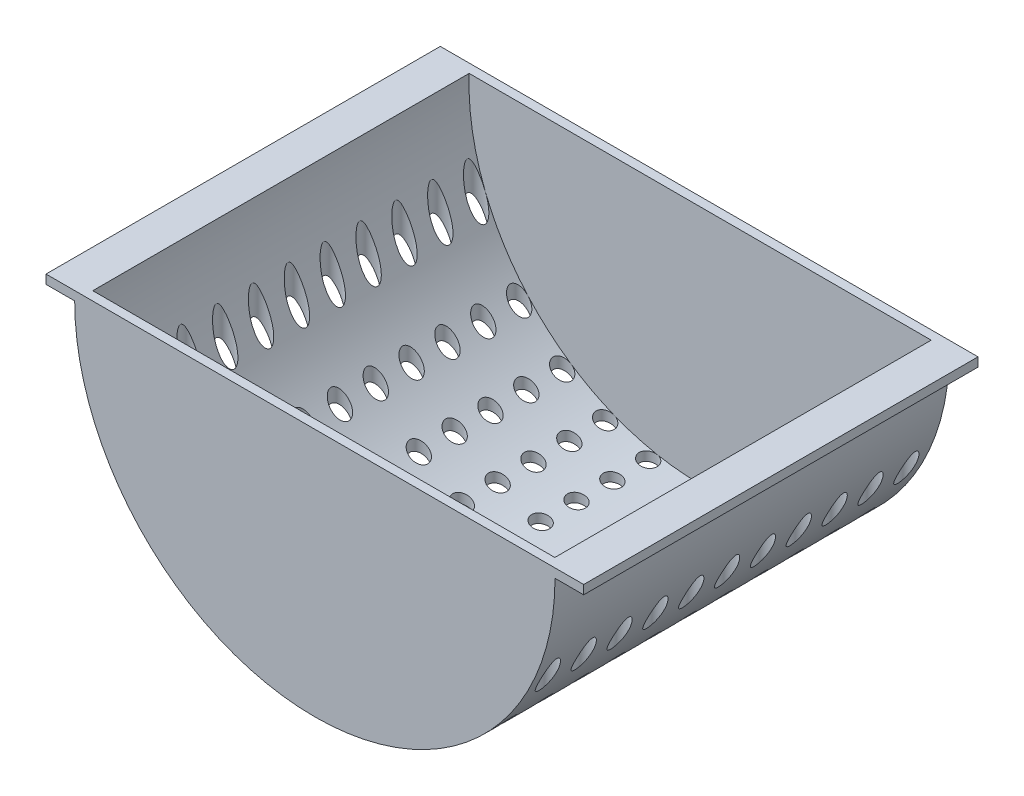
from build123d import *

# Parameters (mm, degrees)
RESSALTO_EXTRUS_O1_DEPTH = 110
CASCA1_START             = 2.5
CASCA1_DEPTH             = 105
ESBO_O3_R                = 2.5000000000000093
ESBO_O3_R_2              = 2.5000000000000027
ESBO_O3_R_3              = 2.5000000000000226
ESBO_O3_R_4              = 2.4999999999999956
CORTE_EXTRUS_O1_DEPTH    = 199.57051644189275


# Read off the part's stored shape, not the designer's step: Casca1
with BuildPart() as part:
    # Esboço2 → Ressalto-extrusão1 (new body)
    with BuildSketch(Plane.XY):
        with BuildLine():
            Line((0, 0), (-150, -1.837e-14))
            Line((-150, -1.837e-14), (-150, -2.5000000000000178))
            Line((-150, -2.5000000000000178), (-141.99999999999997, -2.5000000000000178))
            ThreePointArc((-141.99999999999997, -2.5000000000000178), (-75, -69.5), (-8, -2.4999999999999996))
            Line((-8, -2.4999999999999996), (0, -2.4999999999999996))
            Line((0, -2.4999999999999996), (0, 0))
        make_face()
    extrude(amount=RESSALTO_EXTRUS_O1_DEPTH)

    # Casca1 outline → Casca1 (cut)
    with BuildSketch(Plane.XY.offset(CASCA1_START)):
        with BuildLine():
            ThreePointArc((-139.451532177, 0), (-75, -67), (-10.548467823, 0))
            Line((-10.548467823, 0), (-139.451532177, 0))
        make_face()
    extrude(amount=CASCA1_DEPTH, mode=Mode.SUBTRACT)

    # Esboço3 → Corte-extrusão1 (cut, through all)
    with BuildSketch(Plane(origin=(0, 0, 0), x_dir=(1, 0, 0), z_dir=(0, 1, 0))):
        with Locations(Location((-75, -55, 0), (0, 0, 270))):
            Circle(ESBO_O3_R)
        with Locations(Location((-63, -55, 0), (0, 0, 270))):
            Circle(ESBO_O3_R)
        with Locations(Location((-51, -55, 0), (0, 0, 270))):
            Circle(ESBO_O3_R)
        with Locations(Location((-38.99999999999999, -55, 0), (0, 0, 270))):
            Circle(ESBO_O3_R)
        with Locations(Location((-26.999999999999996, -55, 0), (0, 0, 270))):
            Circle(ESBO_O3_R)
        with Locations(Location((-15, -55, 0), (0, 0, 270))):
            Circle(ESBO_O3_R)
        with Locations(Location((-63.00000000000003, -45, 0), (0, 0, 270))):
            Circle(ESBO_O3_R)
        with Locations(Location((-51.00000000000003, -45, 0), (0, 0, 270))):
            Circle(ESBO_O3_R)
        with Locations(Location((-39.00000000000003, -45, 0), (0, 0, 270))):
            Circle(ESBO_O3_R)
        with Locations(Location((-27.000000000000032, -45, 0), (0, 0, 270))):
            Circle(ESBO_O3_R)
        with Locations(Location((-15.000000000000034, -45, 0), (0, 0, 270))):
            Circle(ESBO_O3_R)
        with Locations(Location((-63.00000000000007, -35, 0), (0, 0, 270))):
            Circle(ESBO_O3_R)
        with Locations(Location((-51.000000000000064, -35, 0), (0, 0, 270))):
            Circle(ESBO_O3_R)
        with Locations(Location((-39.000000000000064, -35, 0), (0, 0, 270))):
            Circle(ESBO_O3_R)
        with Locations(Location((-27.000000000000064, -35, 0), (0, 0, 270))):
            Circle(ESBO_O3_R)
        with Locations(Location((-15.00000000000007, -35, 0), (0, 0, 270))):
            Circle(ESBO_O3_R)
        with Locations(Location((-63.0000000000001, -25, 0), (0, 0, 270))):
            Circle(ESBO_O3_R)
        with Locations(Location((-51.0000000000001, -25, 0), (0, 0, 270))):
            Circle(ESBO_O3_R)
        with Locations(Location((-39.0000000000001, -25, 0), (0, 0, 270))):
            Circle(ESBO_O3_R)
        with Locations(Location((-27.0000000000001, -25, 0), (0, 0, 270))):
            Circle(ESBO_O3_R)
        with Locations(Location((-15.000000000000103, -25, 0), (0, 0, 270))):
            Circle(ESBO_O3_R)
        with Locations(Location((-63.00000000000014, -15, 0), (0, 0, 270))):
            Circle(ESBO_O3_R)
        with Locations(Location((-51.000000000000135, -15, 0), (0, 0, 270))):
            Circle(ESBO_O3_R)
        with Locations(Location((-39.000000000000135, -15, 0), (0, 0, 270))):
            Circle(ESBO_O3_R)
        with Locations(Location((-27.000000000000135, -15, 0), (0, 0, 270))):
            Circle(ESBO_O3_R)
        with Locations(Location((-15.000000000000139, -15, 0), (0, 0, 270))):
            Circle(ESBO_O3_R)
        with Locations(Location((-63.00000000000017, -4.999999999999997, 0), (0, 0, 270))):
            Circle(ESBO_O3_R_2)
        with Locations(Location((-51.00000000000017, -4.999999999999997, 0), (0, 0, 270))):
            Circle(ESBO_O3_R)
        with Locations(Location((-39.00000000000016, -4.999999999999997, 0), (0, 0, 270))):
            Circle(ESBO_O3_R)
        with Locations(Location((-27.00000000000017, -4.999999999999997, 0), (0, 0, 270))):
            Circle(ESBO_O3_R)
        with Locations(Location((-15.000000000000172, -4.999999999999997, 0), (0, 0, 270))):
            Circle(ESBO_O3_R)
        with Locations(Location((-75.00000000000004, -45, 0), (0, 0, 270))):
            Circle(ESBO_O3_R)
        with Locations(Location((-75.00000000000007, -35, 0), (0, 0, 270))):
            Circle(ESBO_O3_R)
        with Locations(Location((-75.00000000000011, -25, 0), (0, 0, 270))):
            Circle(ESBO_O3_R)
        with Locations(Location((-75.00000000000014, -15, 0), (0, 0, 270))):
            Circle(ESBO_O3_R)
        with Locations(Location((-75.00000000000017, -4.999999999999997, 0), (0, 0, 270))):
            Circle(ESBO_O3_R)
        with Locations(Location((-75.00000000000017, -105.00000000000001, 0), (0, 0, 270))):
            Circle(ESBO_O3_R)
        with Locations(Location((-75.00000000000014, -95, 0), (0, 0, 270))):
            Circle(ESBO_O3_R)
        with Locations(Location((-75.00000000000011, -84.99999999999999, 0), (0, 0, 270))):
            Circle(ESBO_O3_R)
        with Locations(Location((-75.00000000000007, -75, 0), (0, 0, 270))):
            Circle(ESBO_O3_R)
        with Locations(Location((-75.00000000000004, -65, 0), (0, 0, 270))):
            Circle(ESBO_O3_R)
        with Locations(Location((-15.000000000000172, -104.99999999999999, 0), (0, 0, 270))):
            Circle(ESBO_O3_R)
        with Locations(Location((-27.00000000000017, -104.99999999999999, 0), (0, 0, 270))):
            Circle(ESBO_O3_R)
        with Locations(Location((-39.00000000000016, -104.99999999999999, 0), (0, 0, 270))):
            Circle(ESBO_O3_R)
        with Locations(Location((-51.00000000000017, -105.00000000000001, 0), (0, 0, 270))):
            Circle(ESBO_O3_R)
        with Locations(Location((-63.00000000000017, -105.00000000000001, 0), (0, 0, 270))):
            Circle(ESBO_O3_R_2)
        with Locations(Location((-15.000000000000139, -94.99999999999999, 0), (0, 0, 270))):
            Circle(ESBO_O3_R)
        with Locations(Location((-27.000000000000135, -94.99999999999999, 0), (0, 0, 270))):
            Circle(ESBO_O3_R)
        with Locations(Location((-39.000000000000135, -94.99999999999999, 0), (0, 0, 270))):
            Circle(ESBO_O3_R)
        with Locations(Location((-51.000000000000135, -95, 0), (0, 0, 270))):
            Circle(ESBO_O3_R)
        with Locations(Location((-63.00000000000014, -95, 0), (0, 0, 270))):
            Circle(ESBO_O3_R)
        with Locations(Location((-15.000000000000103, -84.99999999999999, 0), (0, 0, 270))):
            Circle(ESBO_O3_R)
        with Locations(Location((-27.0000000000001, -84.99999999999999, 0), (0, 0, 270))):
            Circle(ESBO_O3_R)
        with Locations(Location((-39.0000000000001, -84.99999999999999, 0), (0, 0, 270))):
            Circle(ESBO_O3_R)
        with Locations(Location((-51.0000000000001, -84.99999999999999, 0), (0, 0, 270))):
            Circle(ESBO_O3_R)
        with Locations(Location((-63.0000000000001, -84.99999999999999, 0), (0, 0, 270))):
            Circle(ESBO_O3_R)
        with Locations(Location((-15.00000000000007, -74.99999999999999, 0), (0, 0, 270))):
            Circle(ESBO_O3_R)
        with Locations(Location((-27.000000000000064, -74.99999999999999, 0), (0, 0, 270))):
            Circle(ESBO_O3_R)
        with Locations(Location((-39.000000000000064, -74.99999999999999, 0), (0, 0, 270))):
            Circle(ESBO_O3_R)
        with Locations(Location((-51.000000000000064, -74.99999999999999, 0), (0, 0, 270))):
            Circle(ESBO_O3_R)
        with Locations(Location((-63.00000000000007, -75, 0), (0, 0, 270))):
            Circle(ESBO_O3_R)
        with Locations(Location((-15.000000000000034, -64.99999999999999, 0), (0, 0, 270))):
            Circle(ESBO_O3_R)
        with Locations(Location((-27.000000000000032, -64.99999999999999, 0), (0, 0, 270))):
            Circle(ESBO_O3_R)
        with Locations(Location((-39.00000000000003, -65, 0), (0, 0, 270))):
            Circle(ESBO_O3_R)
        with Locations(Location((-51.00000000000003, -65, 0), (0, 0, 270))):
            Circle(ESBO_O3_R)
        with Locations(Location((-63.00000000000003, -65, 0), (0, 0, 270))):
            Circle(ESBO_O3_R)
        with Locations(Location((-87.00000000000033, -65, 0), (0, 0, 270))):
            Circle(ESBO_O3_R)
        with Locations(Location((-99.00000000000033, -65, 0), (0, 0, 270))):
            Circle(ESBO_O3_R)
        with Locations(Location((-111.00000000000033, -65, 0), (0, 0, 270))):
            Circle(ESBO_O3_R_3)
        with Locations(Location((-123.00000000000033, -64.99999999999999, 0), (0, 0, 270))):
            Circle(ESBO_O3_R_4)
        with Locations(Location((-135.0000000000003, -64.99999999999999, 0), (0, 0, 270))):
            Circle(ESBO_O3_R_3)
        with Locations(Location((-87.00000000000028, -75, 0), (0, 0, 270))):
            Circle(ESBO_O3_R)
        with Locations(Location((-99.00000000000028, -74.99999999999999, 0), (0, 0, 270))):
            Circle(ESBO_O3_R_3)
        with Locations(Location((-111.0000000000003, -74.99999999999999, 0), (0, 0, 270))):
            Circle(ESBO_O3_R)
        with Locations(Location((-123.00000000000028, -74.99999999999999, 0), (0, 0, 270))):
            Circle(ESBO_O3_R)
        with Locations(Location((-135.00000000000028, -74.99999999999999, 0), (0, 0, 270))):
            Circle(ESBO_O3_R_3)
        with Locations(Location((-87.00000000000026, -84.99999999999999, 0), (0, 0, 270))):
            Circle(ESBO_O3_R)
        with Locations(Location((-99.00000000000026, -84.99999999999999, 0), (0, 0, 270))):
            Circle(ESBO_O3_R)
        with Locations(Location((-111.00000000000027, -84.99999999999999, 0), (0, 0, 270))):
            Circle(ESBO_O3_R_4)
        with Locations(Location((-123.00000000000024, -84.99999999999999, 0), (0, 0, 270))):
            Circle(ESBO_O3_R_3)
        with Locations(Location((-135.00000000000026, -84.99999999999999, 0), (0, 0, 270))):
            Circle(ESBO_O3_R_4)
        with Locations(Location((-87.00000000000021, -95, 0), (0, 0, 270))):
            Circle(ESBO_O3_R)
        with Locations(Location((-99.00000000000023, -95, 0), (0, 0, 270))):
            Circle(ESBO_O3_R_4)
        with Locations(Location((-111.00000000000023, -94.99999999999999, 0), (0, 0, 270))):
            Circle(ESBO_O3_R)
        with Locations(Location((-123.00000000000023, -94.99999999999999, 0), (0, 0, 270))):
            Circle(ESBO_O3_R_3)
        with Locations(Location((-135.00000000000023, -94.99999999999999, 0), (0, 0, 270))):
            Circle(ESBO_O3_R_4)
        with Locations(Location((-87.00000000000018, -105.00000000000001, 0), (0, 0, 270))):
            Circle(ESBO_O3_R_4)
        with Locations(Location((-99.00000000000018, -105.00000000000001, 0), (0, 0, 270))):
            Circle(ESBO_O3_R)
        with Locations(Location((-111.00000000000018, -104.99999999999999, 0), (0, 0, 270))):
            Circle(ESBO_O3_R_3)
        with Locations(Location((-123.0000000000002, -104.99999999999999, 0), (0, 0, 270))):
            Circle(ESBO_O3_R_4)
        with Locations(Location((-135.00000000000017, -104.99999999999999, 0), (0, 0, 270))):
            Circle(ESBO_O3_R_3)
        with Locations(Location((-135.00000000000017, -4.999999999999997, 0), (0, 0, 270))):
            Circle(ESBO_O3_R_3)
        with Locations(Location((-123.0000000000002, -4.999999999999997, 0), (0, 0, 270))):
            Circle(ESBO_O3_R_4)
        with Locations(Location((-111.00000000000018, -4.999999999999997, 0), (0, 0, 270))):
            Circle(ESBO_O3_R_3)
        with Locations(Location((-99.00000000000018, -4.999999999999997, 0), (0, 0, 270))):
            Circle(ESBO_O3_R)
        with Locations(Location((-87.00000000000018, -4.999999999999997, 0), (0, 0, 270))):
            Circle(ESBO_O3_R_4)
        with Locations(Location((-135.00000000000023, -15, 0), (0, 0, 270))):
            Circle(ESBO_O3_R_4)
        with Locations(Location((-123.00000000000023, -15, 0), (0, 0, 270))):
            Circle(ESBO_O3_R_3)
        with Locations(Location((-111.00000000000023, -15, 0), (0, 0, 270))):
            Circle(ESBO_O3_R)
        with Locations(Location((-99.00000000000023, -15, 0), (0, 0, 270))):
            Circle(ESBO_O3_R_4)
        with Locations(Location((-87.00000000000021, -15, 0), (0, 0, 270))):
            Circle(ESBO_O3_R)
        with Locations(Location((-135.00000000000026, -25, 0), (0, 0, 270))):
            Circle(ESBO_O3_R_4)
        with Locations(Location((-123.00000000000024, -25, 0), (0, 0, 270))):
            Circle(ESBO_O3_R_3)
        with Locations(Location((-111.00000000000027, -25, 0), (0, 0, 270))):
            Circle(ESBO_O3_R_4)
        with Locations(Location((-99.00000000000026, -25, 0), (0, 0, 270))):
            Circle(ESBO_O3_R)
        with Locations(Location((-87.00000000000026, -25, 0), (0, 0, 270))):
            Circle(ESBO_O3_R)
        with Locations(Location((-135.00000000000028, -35, 0), (0, 0, 270))):
            Circle(ESBO_O3_R_3)
        with Locations(Location((-123.00000000000028, -35, 0), (0, 0, 270))):
            Circle(ESBO_O3_R)
        with Locations(Location((-111.0000000000003, -35, 0), (0, 0, 270))):
            Circle(ESBO_O3_R)
        with Locations(Location((-99.00000000000028, -35, 0), (0, 0, 270))):
            Circle(ESBO_O3_R_3)
        with Locations(Location((-87.00000000000028, -35, 0), (0, 0, 270))):
            Circle(ESBO_O3_R)
        with Locations(Location((-135.0000000000003, -45, 0), (0, 0, 270))):
            Circle(ESBO_O3_R_3)
        with Locations(Location((-123.00000000000033, -45, 0), (0, 0, 270))):
            Circle(ESBO_O3_R_4)
        with Locations(Location((-111.00000000000033, -45, 0), (0, 0, 270))):
            Circle(ESBO_O3_R_3)
        with Locations(Location((-99.00000000000033, -45, 0), (0, 0, 270))):
            Circle(ESBO_O3_R)
        with Locations(Location((-87.00000000000033, -45, 0), (0, 0, 270))):
            Circle(ESBO_O3_R)
        with Locations(Location((-135.00000000000034, -55, 0), (0, 0, 270))):
            Circle(ESBO_O3_R_3)
        with Locations(Location((-123.00000000000036, -55, 0), (0, 0, 270))):
            Circle(ESBO_O3_R_4)
        with Locations(Location((-111.00000000000036, -55, 0), (0, 0, 270))):
            Circle(ESBO_O3_R)
        with Locations(Location((-99.00000000000037, -55, 0), (0, 0, 270))):
            Circle(ESBO_O3_R_4)
        with Locations(Location((-87.00000000000036, -55, 0), (0, 0, 270))):
            Circle(ESBO_O3_R)
    extrude(amount=-CORTE_EXTRUS_O1_DEPTH, mode=Mode.SUBTRACT)


solid = part.part
